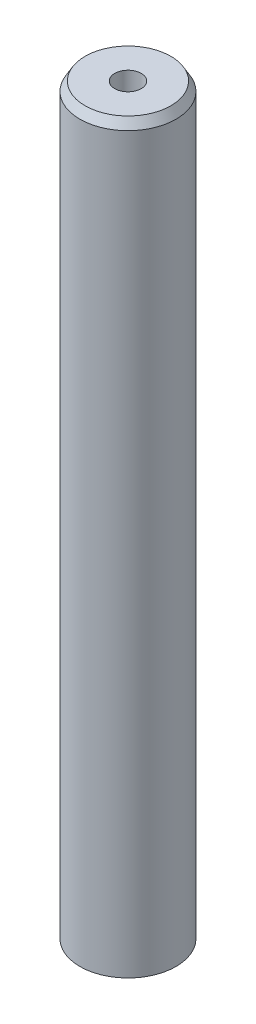
from build123d import *
from OCP.BRepFilletAPI import BRepFilletAPI_MakeChamfer

# Parameters (mm, degrees)
SKETCH1_R           = 10
BOSS_EXTRUDE1_DEPTH = 155.53805912
SKETCH2_R           = 2.754673165
CUT_EXTRUDE1_DEPTH  = 157.179665241
CHAMFER1_SIZE       = 1.877249183
CHAMFER1_SIZE2      = 1.083830321


with BuildPart() as part:
    # Sketch1 → Boss-Extrude1 (new body)
    with BuildSketch(Plane(origin=(0, 0, 0), x_dir=(1, 0, 0), z_dir=(0, 1, 0))):
        Circle(SKETCH1_R)
    extrude(amount=BOSS_EXTRUDE1_DEPTH)

    # Sketch2 → Cut-Extrude1 (cut, through all)
    with BuildSketch(Plane(origin=(0, 0, 0), x_dir=(1, 0, 0), z_dir=(0, 1, 0))):
        Circle(SKETCH2_R)
    extrude(amount=CUT_EXTRUDE1_DEPTH, mode=Mode.SUBTRACT)

    # Chamfer1: one chamfer whose edges measure the first distance from different faces: ONE call of the kernel's chamfer builder (chamfer() names one face for all edges)
    chamfer1_edges_1 = [part.edges().sort_by_distance(p)[0] for p in [
        (-10, 155.53805912, 0),
    ]]
    chamfer1_side_1 = [part.faces().sort_by_distance(p)[0] for p in [
        (-10, 77.76902956, 0),
    ]]
    chamfer1_edges_2 = [part.edges().sort_by_distance(p)[0] for p in [
        (-10, 0, 0),
    ]]
    chamfer1_side_2 = [part.faces().sort_by_distance(p)[0] for p in [
        (-9.717157288, 0, 0),
    ]]
    chamfer1 = BRepFilletAPI_MakeChamfer(part.part.solid().wrapped)
    for e in chamfer1_edges_1:
        chamfer1.Add(CHAMFER1_SIZE, CHAMFER1_SIZE2, e.wrapped, chamfer1_side_1[0].wrapped)  # the first distance lies on this face
    for e in chamfer1_edges_2:
        chamfer1.Add(CHAMFER1_SIZE, CHAMFER1_SIZE2, e.wrapped, chamfer1_side_2[0].wrapped)  # the first distance lies on this face
    add(Compound.cast(chamfer1.Shape()), mode=Mode.REPLACE)


solid = part.part
